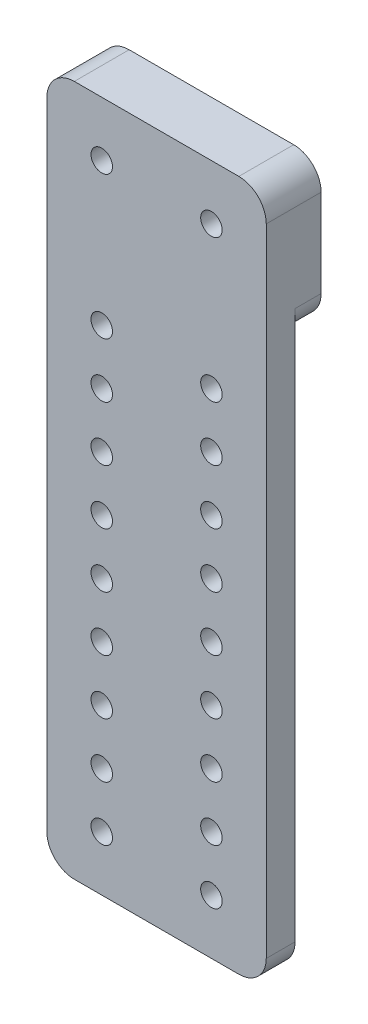
from build123d import *

# Parameters (mm, degrees)
SKETCH2_W           = 50.8
SKETCH2_H           = 160.02
BOSS_EXTRUDE1_DEPTH = 12.7
SKETCH3_R           = 2.4892
CUT_EXTRUDE1_DEPTH  = 169.369624339
FILLET1_R           = 6.35
SKETCH5_W           = 6.0325
SKETCH5_H           = 127
CUT_EXTRUDE2_DEPTH  = 169.369624339
FILLET2_R           = 6.35


with BuildPart() as part:
    # Sketch2 → Boss-Extrude1 (new body)
    with BuildSketch(Plane.XY):
        with Locations((25.4, 80.01)):
            Rectangle(SKETCH2_W, SKETCH2_H)
    extrude(amount=-BOSS_EXTRUDE1_DEPTH)

    # Sketch3 → Cut-Extrude1 (cut, through all)
    with BuildSketch(Plane.XY):
        with Locations((12.7, 147.32)):
            Circle(SKETCH3_R)
        with Locations((38.1, 147.32)):
            Circle(SKETCH3_R)
        with Locations((12.7, 114.3)):
            Circle(SKETCH3_R)
        with Locations((12.7, 101.6)):
            Circle(SKETCH3_R)
        with Locations((12.7, 88.9)):
            Circle(SKETCH3_R)
        with Locations((12.7, 76.2)):
            Circle(SKETCH3_R)
        with Locations((12.7, 63.5)):
            Circle(SKETCH3_R)
        with Locations((12.7, 50.8)):
            Circle(SKETCH3_R)
        with Locations((12.7, 38.1)):
            Circle(SKETCH3_R)
        with Locations((12.7, 25.4)):
            Circle(SKETCH3_R)
        with Locations((12.7, 12.7)):
            Circle(SKETCH3_R)
        with Locations((38.1, 101.6)):
            Circle(SKETCH3_R)
        with Locations((38.1, 88.9)):
            Circle(SKETCH3_R)
        with Locations((38.1, 76.2)):
            Circle(SKETCH3_R)
        with Locations((38.1, 63.5)):
            Circle(SKETCH3_R)
        with Locations((38.1, 50.8)):
            Circle(SKETCH3_R)
        with Locations((38.1, 38.1)):
            Circle(SKETCH3_R)
        with Locations((38.1, 25.4)):
            Circle(SKETCH3_R)
        with Locations((38.1, 12.7)):
            Circle(SKETCH3_R)
        with Locations((38.1, 114.3)):
            Circle(SKETCH3_R)
    extrude(amount=-CUT_EXTRUDE1_DEPTH, mode=Mode.SUBTRACT)

    # Fillet1
    fillet1_edges = [part.edges().sort_by_distance(p)[0] for p in [
        (0, 0, -6.35),
        (50.8, 0, -6.35),
        (50.8, 160.02, -6.35),
        (0, 160.02, -6.35),
    ]]
    fillet(fillet1_edges, radius=FILLET1_R)

    # Sketch5 → Cut-Extrude2 (cut, through all)
    with BuildSketch(Plane(origin=(50.8, 0, 0), x_dir=(0, 0, -1), z_dir=(1, 0, 0))):
        with Locations((9.68375, 63.5)):
            Rectangle(SKETCH5_W, SKETCH5_H)
    extrude(amount=-CUT_EXTRUDE2_DEPTH, mode=Mode.SUBTRACT)

    # Fillet2
    fillet2_edges = [part.edges().sort_by_distance(p)[0] for p in [
        (0, 127, -9.68375),
        (50.8, 127, -9.68375),
    ]]
    fillet(fillet2_edges, radius=FILLET2_R)


solid = part.part
